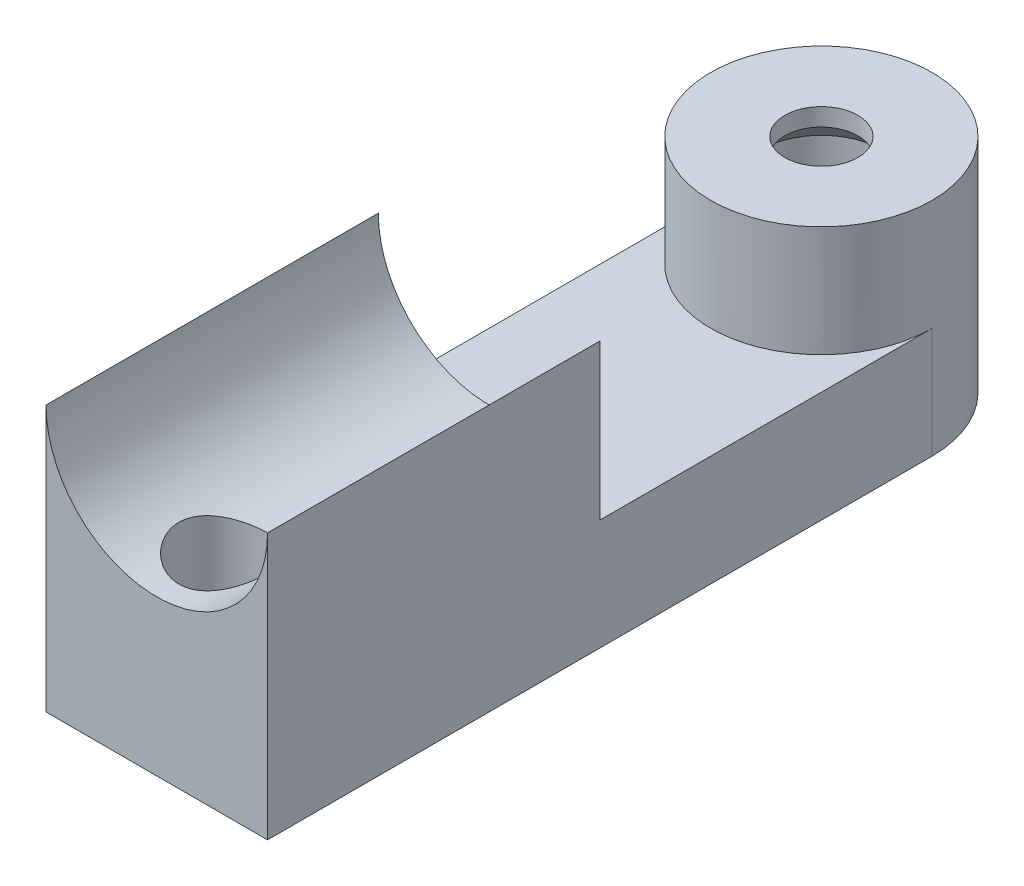
from build123d import *

# Parameters (mm, degrees)
SKETCH1_R           = 5
SKETCH1_R_2         = 1.65
BOSS_EXTRUDE1_DEPTH = 5
BOSS_EXTRUDE2_START = 5
BOSS_EXTRUDE2_DEPTH = 5
BOSS_EXTRUDE3_DEPTH = 15
CUT_EXTRUDE1_START  = -1.9
SKETCH4_R           = 2
CUT_EXTRUDE1_DEPTH  = 31.795565449
SKETCH6_R           = 2.75
CUT_EXTRUDE2_DEPTH  = 8
CHAMFER1_SIZE       = 1.2


with BuildPart() as part:
    # Sketch1 → Boss-Extrude1 (new body)
    with BuildSketch(Plane(origin=(0, 0, 0), x_dir=(1, 0, 0), z_dir=(0, 1, 0))):
        with Locations(Location((0, 0, 0), (0, 0, 270))):
            Circle(SKETCH1_R)
        with Locations(Location((0, 0, 0), (0, 0, 270))):
            Circle(SKETCH1_R_2, mode=Mode.SUBTRACT)
    extrude(amount=BOSS_EXTRUDE1_DEPTH)

    # Sketch2 → Boss-Extrude2 (add)
    with BuildSketch(Plane.XZ.offset(BOSS_EXTRUDE2_START)):
        with BuildLine():
            Line((-5, 0), (-5, 30))
            Line((-5, 30), (5, 30))
            Line((5, 30), (5, 0))
            ThreePointArc((5, 0), (0, -5), (-5, 0))
        make_face()
    extrude(amount=-BOSS_EXTRUDE2_DEPTH)

    # Sketch3 → Boss-Extrude3 (add)
    with BuildSketch(Plane.XY.offset(30)):
        with BuildLine():
            Line((-5, 0), (-5, 7))
            ThreePointArc((-5, 7), (0, 2), (5, 7))
            Line((5, 7), (5, 0))
            Line((5, 0), (5, -5))
            Line((5, -5), (-5, -5))
            Line((-5, -5), (-5, 0))
        make_face()
    extrude(amount=-BOSS_EXTRUDE3_DEPTH)

    # Sketch4 → Cut-Extrude1 (cut, through all)
    with BuildSketch(Plane.XZ.offset(5).offset(CUT_EXTRUDE1_START)):
        with Locations(Location((0, 27, 0), (0, 0, 270))):
            Circle(SKETCH4_R)
    extrude(amount=-CUT_EXTRUDE1_DEPTH, mode=Mode.SUBTRACT)

    # Sketch6 → Cut-Extrude2 (cut)
    with BuildSketch(Plane.XZ.offset(5)):
        with Locations(Location((0, 0, 0), (0, 0, 270))):
            Circle(SKETCH6_R)
    extrude(amount=-CUT_EXTRUDE2_DEPTH, mode=Mode.SUBTRACT)

    # Chamfer1
    # the kernel refuses this chamfer: 1.2 mm, written as the material it takes off along each edge
    with BuildSketch(Plane(origin=(0, 3, 0), x_dir=(0, 0, 1), z_dir=(1, 0, 0))) as chamfer1_piece_1_section:
        Polygon((1.65, -CHAMFER1_SIZE), (1.65 + CHAMFER1_SIZE, 0), (1.65, 0), align=None)
    chamfer1_piece_1 = revolve(axis=Axis((0, 3, 0), (0, -1, 0)), mode=Mode.PRIVATE)
    chamfer1_piece_1 = chamfer1_piece_1 & Plane(origin=(0, 3.651745374, 0), x_dir=(0, 0, -1), z_dir=(0, -1, 0)) * Cylinder(2.75, 12, mode=Mode.PRIVATE)
    add(chamfer1_piece_1, mode=Mode.SUBTRACT)


solid = part.part
